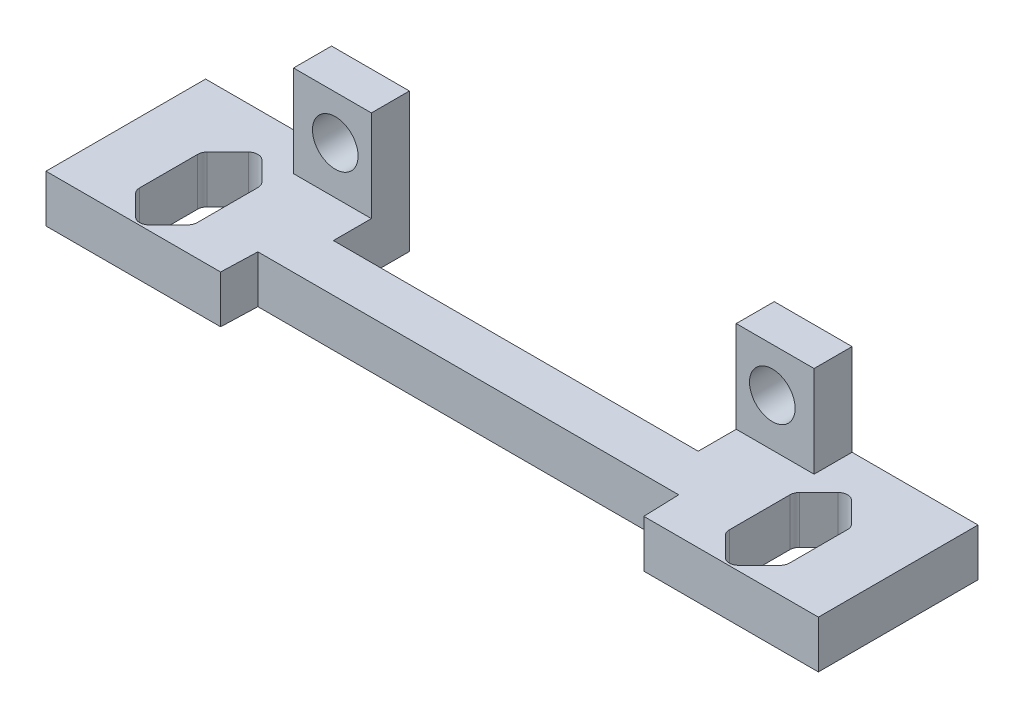
from build123d import *

# Parameters (mm, degrees)
EXTRUDE_1725_DEPTH   = 2.5
EXTRUDE_1725_2_DEPTH = 2.5
SKETCH_3_W           = 4.096784854
SKETCH_3_H           = 4.817676116
SKETCH_3_R           = 1.2
EXTRUDE_1_DEPTH      = 2
EXTRUDE_2_REACH      = 41.086
SKETCH_5_W           = 2.5
SKETCH_5_H           = 2.5


with BuildPart() as part:
    # 草图2 → Extrude 1725 (new body)
    with BuildSketch(Plane(origin=(0, 0, 0), x_dir=(1, 0, 0), z_dir=(0, 1, 0))):
        Polygon((11.136061282, -24.056246494), (20.323880385, -24.056246494), (20.323880385, -15.656749138), (17.100927376, -15.656749138), (14.000927376, -15.656749138), (10.862052049, -15.656749138), (9.6, -15.656749138), (9.6, -22.156749138), (11.073569208, -22.156749138), align=None)
        with BuildLine():
            Line((14.000927376, -19.227513168), (14.000927376, -22.422888537))
            ThreePointArc((14.000927376, -22.422888537), (14.03898761, -22.614230253), (14.147373985, -22.776441927))
            Line((14.147373985, -22.776441927), (15.162186301, -23.791254243))
            ThreePointArc((15.162186301, -23.791254243), (15.515739691, -23.937700852), (15.869293082, -23.791254243))
            Line((15.869293082, -23.791254243), (16.954480766, -22.706066558))
            ThreePointArc((16.954480766, -22.706066558), (17.062867142, -22.543854884), (17.100927376, -22.352513168))
            Line((17.100927376, -22.352513168), (17.100927376, -19.297888537))
            ThreePointArc((17.100927376, -19.297888537), (17.062867142, -19.10654682), (16.954480766, -18.944335146))
            Line((16.954480766, -18.944335146), (15.869293082, -17.859147462))
            ThreePointArc((15.869293082, -17.859147462), (15.515739691, -17.712700852), (15.162186301, -17.859147462))
            Line((15.162186301, -17.859147462), (14.147373985, -18.873959777))
            ThreePointArc((14.147373985, -18.873959777), (14.03898761, -19.036171452), (14.000927376, -19.227513168))
        make_face(mode=Mode.SUBTRACT)
    extrude(amount=EXTRUDE_1725_DEPTH)



with BuildPart() as body_2:
    # 草图2 → Extrude 1725 2 (new body)
    with BuildSketch(Plane(origin=(0, 0, 0), x_dir=(1, 0, 0), z_dir=(0, 1, 0))):
        Polygon((-11.136061282, -24.056246494), (-20.323880385, -24.056246494), (-20.323880385, -15.656749138), (-17.100927376, -15.656749138), (-14.000927376, -15.656749138), (-10.862052049, -15.656749138), (-9.6, -15.656749138), (-9.6, -22.156749138), (-11.073569208, -22.156749138), align=None)
        with BuildLine():
            Line((-14.000927376, -19.227513168), (-14.000927376, -22.422888537))
            ThreePointArc((-14.000927376, -22.422888537), (-14.03898761, -22.614230253), (-14.147373985, -22.776441927))
            Line((-14.147373985, -22.776441927), (-15.162186301, -23.791254243))
            ThreePointArc((-15.162186301, -23.791254243), (-15.515739691, -23.937700852), (-15.869293082, -23.791254243))
            Line((-15.869293082, -23.791254243), (-16.954480766, -22.706066558))
            ThreePointArc((-16.954480766, -22.706066558), (-17.062867142, -22.543854884), (-17.100927376, -22.352513168))
            Line((-17.100927376, -22.352513168), (-17.100927376, -19.297888537))
            ThreePointArc((-17.100927376, -19.297888537), (-17.062867142, -19.10654682), (-16.954480766, -18.944335146))
            Line((-16.954480766, -18.944335146), (-15.869293082, -17.859147462))
            ThreePointArc((-15.869293082, -17.859147462), (-15.515739691, -17.712700852), (-15.162186301, -17.859147462))
            Line((-15.162186301, -17.859147462), (-14.147373985, -18.873959777))
            ThreePointArc((-14.147373985, -18.873959777), (-14.03898761, -19.036171452), (-14.000927376, -19.227513168))
        make_face(mode=Mode.SUBTRACT)
    extrude(amount=EXTRUDE_1725_2_DEPTH)


with BuildPart() as part_1:
    add(part.part)

    add(body_2.part)  # 凸台-拉伸1 merges body 2
    # 草图3 → 凸台-拉伸1 (add)
    # profile 1 of 2: a face of its own
    with BuildSketch(Plane(origin=(0, 0, 15.656749138), x_dir=(-1, 0, 0), z_dir=(0, 0, -1))):
        with Locations((-11.648392427, 4.908838058)):
            Rectangle(SKETCH_3_W, SKETCH_3_H)
        with Locations((-11.5, 5)):
            Circle(SKETCH_3_R, mode=Mode.SUBTRACT)
    # profile 2 of 2: a face of its own
    with BuildSketch(Plane(origin=(0, 0, 15.656749138), x_dir=(-1, 0, 0), z_dir=(0, 0, -1))):
        with Locations((11.648392427, 4.908838058)):
            Rectangle(SKETCH_3_W, SKETCH_3_H)
        with Locations((11.5, 5)):
            Circle(SKETCH_3_R, mode=Mode.SUBTRACT)
    extrude(amount=-EXTRUDE_1_DEPTH)

    # 草图5 → 凸台-拉伸2 (add, up to next)
    with BuildSketch(Plane.ZY.offset(-9.6), mode=Mode.PRIVATE) as extrude_2_sk1:
        with Locations((20.906749138, 1.25)):
            Rectangle(SKETCH_5_W, SKETCH_5_H)
    extrude_2_tool1 = extrude(extrude_2_sk1.sketch, amount=EXTRUDE_2_REACH, mode=Mode.PRIVATE) - part_1.part
    add(extrude_2_tool1.solids().sort_by_distance((9.6, 1.25, 20.906749))[0])


solid = part_1.part
